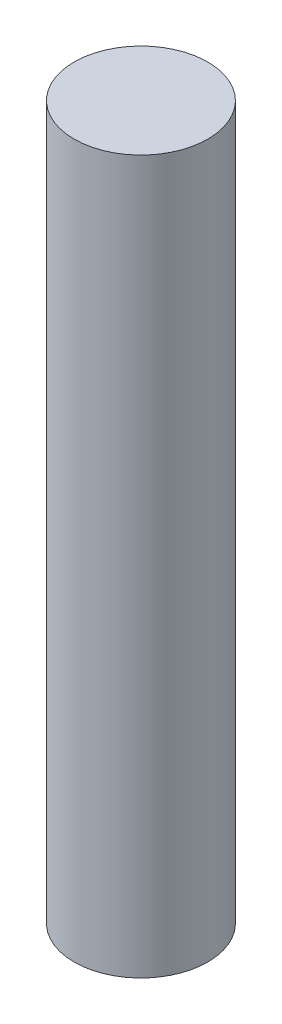
from build123d import *

# Parameters (mm, degrees)
EXTRUDE_1_DEPTH      = 1500
EXTRUDE_1_DEPTH_BACK = 100
SKETCH_2_R           = 150


with BuildPart() as part:
    # 草图2 → 凸台-拉伸1 (new, two sides: drawn at the far end of the back side and taken through both)
    with BuildSketch(Plane(origin=(0, 0, 0), x_dir=(1, 0, 0), z_dir=(0, 1, 0)).offset(-EXTRUDE_1_DEPTH_BACK)):
        Circle(SKETCH_2_R)
    extrude(amount=EXTRUDE_1_DEPTH + EXTRUDE_1_DEPTH_BACK)


solid = part.part
